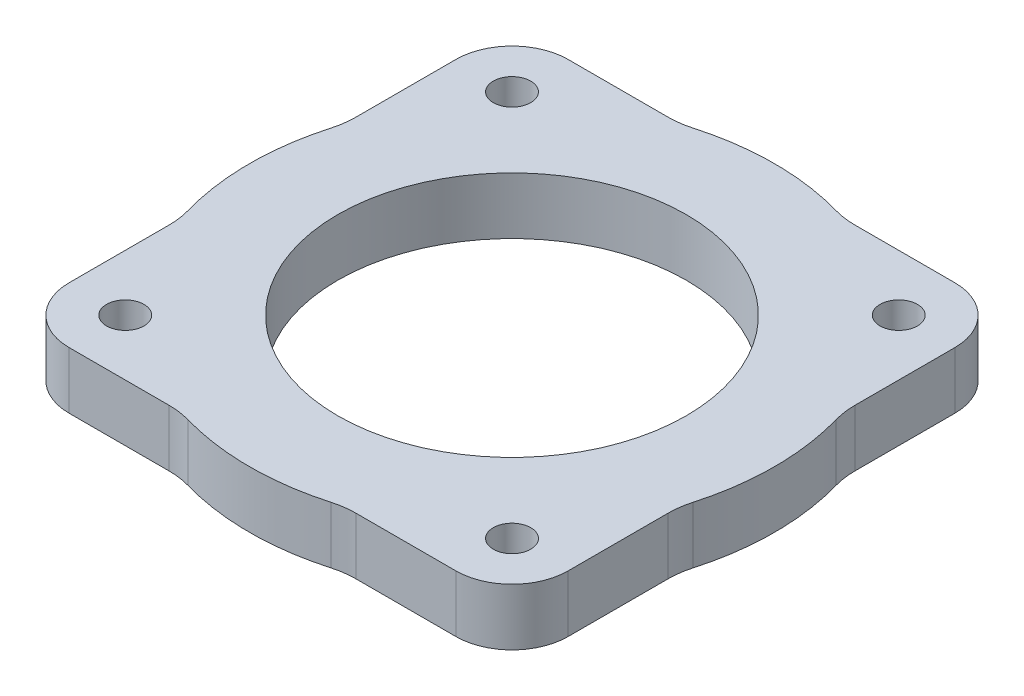
from build123d import *

# Parameters (mm, degrees)
SKETCH1_R           = 22.1742
SKETCH1_R_2         = 2.38125
BOSS_EXTRUDE1_DEPTH = 7.239


with BuildPart() as part:
    # Sketch1 → Boss-Extrude1 (new body)
    with BuildSketch(Plane(origin=(0, 0, 0), x_dir=(1, 0, 0), z_dir=(0, 1, 0))):
        with BuildLine():
            Line((0, 43.62908334), (0, 56.35625))
            ThreePointArc((0, 56.35625), (2.092355932, 61.407644068), (7.14375, 63.5))
            Line((7.14375, 63.5), (19.87091666, 63.5))
            ThreePointArc((19.87091666, 63.5), (21.269548228, 63.596728676), (22.641548343, 63.885072886))
            ThreePointArc((22.641548343, 63.885072886), (31.75, 65.151), (40.858451657, 63.885072886))
            ThreePointArc((40.858451657, 63.885072886), (42.230451772, 63.596728676), (43.62908334, 63.5))
            Line((43.62908334, 63.5), (56.35625, 63.5))
            ThreePointArc((56.35625, 63.5), (61.407644068, 61.407644068), (63.5, 56.35625))
            Line((63.5, 56.35625), (63.5, 43.62908334))
            ThreePointArc((63.5, 43.62908334), (63.596728676, 42.230451772), (63.885072886, 40.858451657))
            ThreePointArc((63.885072886, 40.858451657), (65.151, 31.75), (63.885072886, 22.641548343))
            ThreePointArc((63.885072886, 22.641548343), (63.596728676, 21.269548228), (63.5, 19.87091666))
            Line((63.5, 19.87091666), (63.5, 7.14375))
            ThreePointArc((63.5, 7.14375), (61.407644068, 2.092355932), (56.35625, 0))
            Line((56.35625, 0), (43.62908334, 0))
            ThreePointArc((43.62908334, 0), (42.230451772, -0.096728676), (40.858451657, -0.385072886))
            ThreePointArc((40.858451657, -0.385072886), (31.75, -1.651), (22.641548343, -0.385072886))
            ThreePointArc((22.641548343, -0.385072886), (21.269548228, -0.096728676), (19.87091666, 0))
            Line((19.87091666, 0), (7.14375, 0))
            ThreePointArc((7.14375, 0), (2.092355932, 2.092355932), (0, 7.14375))
            Line((0, 7.14375), (0, 19.87091666))
            ThreePointArc((0, 19.87091666), (-0.096728676, 21.269548228), (-0.385072886, 22.641548343))
            ThreePointArc((-0.385072886, 22.641548343), (-1.651, 31.75), (-0.385072886, 40.858451657))
            ThreePointArc((-0.385072886, 40.858451657), (-0.096728676, 42.230451772), (0, 43.62908334))
        make_face()
        with Locations((31.75, 31.75)):
            Circle(SKETCH1_R, mode=Mode.SUBTRACT)
        with Locations((56.35625, 56.35625)):
            Circle(SKETCH1_R_2, mode=Mode.SUBTRACT)
        with Locations((56.35625, 7.14375)):
            Circle(SKETCH1_R_2, mode=Mode.SUBTRACT)
        with Locations((7.14375, 7.14375)):
            Circle(SKETCH1_R_2, mode=Mode.SUBTRACT)
        with Locations((7.14375, 56.35625)):
            Circle(SKETCH1_R_2, mode=Mode.SUBTRACT)
    extrude(amount=-BOSS_EXTRUDE1_DEPTH)


solid = part.part
